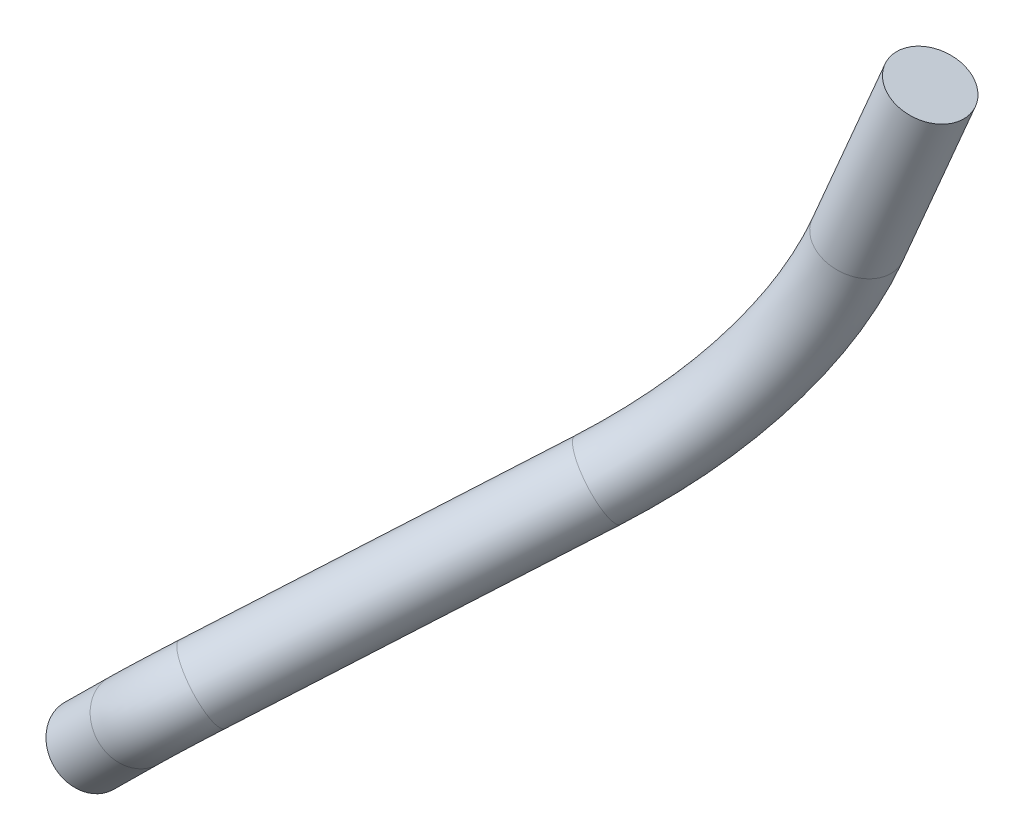
from build123d import *

# Parameters (mm, degrees)
SWEEP1_PROFILE_R = 4.699


with BuildPart() as part:
    # Sweep1: sweep along a curve in space
    with BuildLine() as sweep1_path:
        Line((245.002712239, 143.55300721, 164.375775055), (253.620262722, 165.140017683, 163.321797155))
        ThreePointArc((225.21521404, 113.368458609, 179.11283365), (236.105592038, 126.304329804, 168.665721097), (245.002712239, 143.55300721, 164.375775055))
        Line((200.767546374, 91.716736181, 207.259969752), (225.21521404, 113.368458609, 179.11283365))
        ThreePointArc((200.767546374, 91.716736181, 207.259969752), (197.909240754, 89.095817316, 209.551149084), (194.721290551, 86.015208065, 210.3483))
        Line((194.721290551, 86.015208065, 210.3483), (188.850650435, 80.210806065, 210.3483))
    # Sweep1 profile (on start of the path) → Sweep1 (sweep)
    with BuildSketch(Plane(origin=(188.850650435, 80.210806065, 210.3483), x_dir=(-0.7030837096444024, 0.7111070926609196, 0), z_dir=(0.7111070926609196, 0.7030837096444024, -7.573949905868311e-14))):
        Circle(SWEEP1_PROFILE_R)
    sweep(path=sweep1_path.line)


solid = part.part
